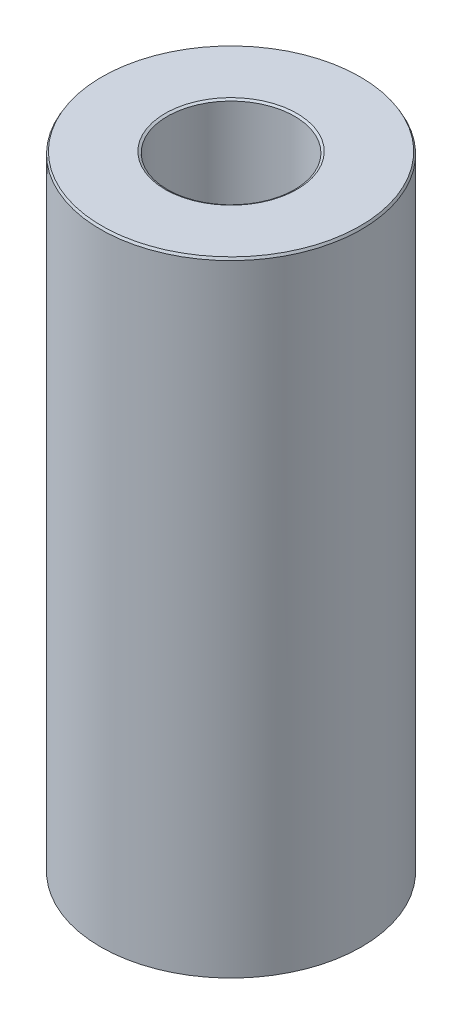
from build123d import *
from OCP.BRepFilletAPI import BRepFilletAPI_MakeChamfer

# Parameters (mm, degrees)
SKETCH1_R           = 52.5
BOSS_EXTRUDE1_DEPTH = 251.429332052
SKETCH2_R           = 25.578379952
CUT_EXTRUDE1_DEPTH  = 263.162562194
CHAMFER1_SIZE       = 0.932442803
CHAMFER1_SIZE2      = 0.538346103


with BuildPart() as part:
    # Sketch1 → Boss-Extrude1 (new body)
    with BuildSketch(Plane(origin=(0, 0, 0), x_dir=(1, 0, 0), z_dir=(0, 1, 0))):
        Circle(SKETCH1_R)
    extrude(amount=BOSS_EXTRUDE1_DEPTH)

    # Sketch2 → Cut-Extrude1 (cut, through all)
    with BuildSketch(Plane(origin=(0, 0, 0), x_dir=(1, 0, 0), z_dir=(0, 1, 0))):
        Circle(SKETCH2_R)
    extrude(amount=CUT_EXTRUDE1_DEPTH, mode=Mode.SUBTRACT)

    # Chamfer1: one chamfer whose edges measure the first distance from different faces: ONE call of the kernel's chamfer builder (chamfer() names one face for all edges)
    chamfer1_edges_1 = [part.edges().sort_by_distance(p)[0] for p in [
        (-25.578379952, 251.429332052, 0),
    ]]
    chamfer1_side_1 = [part.faces().sort_by_distance(p)[0] for p in [
        (-51.01507576, 251.429332052, 0),
    ]]
    chamfer1_edges_2 = [part.edges().sort_by_distance(p)[0] for p in [
        (-25.578379952, 0, 0),
    ]]
    chamfer1_side_2 = [part.faces().sort_by_distance(p)[0] for p in [
        (-25.578379952, 125.714666026, 0),
    ]]
    chamfer1_edges_3 = [part.edges().sort_by_distance(p)[0] for p in [
        (-52.5, 0, 0),
    ]]
    chamfer1_side_3 = [part.faces().sort_by_distance(p)[0] for p in [
        (-51.01507576, 0, 0),
    ]]
    chamfer1_edges_4 = [part.edges().sort_by_distance(p)[0] for p in [
        (-52.5, 251.429332052, 0),
    ]]
    chamfer1_side_4 = [part.faces().sort_by_distance(p)[0] for p in [
        (-52.5, 125.714666026, 0),
    ]]
    chamfer1 = BRepFilletAPI_MakeChamfer(part.part.solid().wrapped)
    for e in chamfer1_edges_1:
        chamfer1.Add(CHAMFER1_SIZE, CHAMFER1_SIZE2, e.wrapped, chamfer1_side_1[0].wrapped)  # the first distance lies on this face
    for e in chamfer1_edges_2:
        chamfer1.Add(CHAMFER1_SIZE, CHAMFER1_SIZE2, e.wrapped, chamfer1_side_2[0].wrapped)  # the first distance lies on this face
    for e in chamfer1_edges_3:
        chamfer1.Add(CHAMFER1_SIZE, CHAMFER1_SIZE2, e.wrapped, chamfer1_side_3[0].wrapped)  # the first distance lies on this face
    for e in chamfer1_edges_4:
        chamfer1.Add(CHAMFER1_SIZE, CHAMFER1_SIZE2, e.wrapped, chamfer1_side_4[0].wrapped)  # the first distance lies on this face
    add(Compound.cast(chamfer1.Shape()), mode=Mode.REPLACE)


solid = part.part
